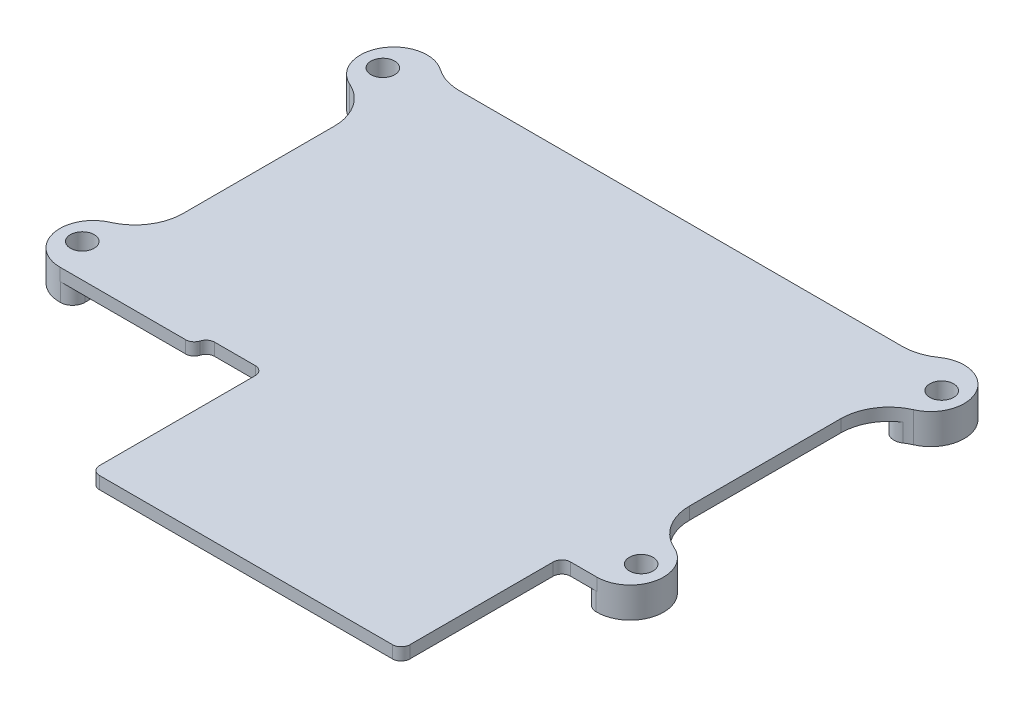
from build123d import *

# Parameters (mm, degrees)
SKETCH1_R             = 1.2192
BOSS_EXTRUDE1_DEPTH   = 3.1242
BOSS_EXTRUDE1_2_DEPTH = 3.1242
BOSS_EXTRUDE1_3_DEPTH = 3.1242
BOSS_EXTRUDE1_4_DEPTH = 3.1242
BOSS_EXTRUDE2_START   = -1.27
SKETCH2_R             = 1.2192
BOSS_EXTRUDE2_DEPTH   = 1.27
SKETCH4_W             = 5.9436
SKETCH4_H             = 1.27
CUT_EXTRUDE1_DEPTH    = 1.27
FILLET1_DEPTH         = 3.1242
FILLET1_START         = 1.8542
FILLET1_2_DEPTH       = 1.27
BOSS_EXTRUDE3_DEPTH   = 1.27
FILLET2_R             = 0.889
FILLET3_R             = 0.889
FILLET5_R             = 1.27


with BuildPart() as part:
    # Sketch1 → Boss-Extrude1 (new body)
    with BuildSketch(Plane(origin=(0, 0, 0), x_dir=(1, 0, 0), z_dir=(0, 1, 0))):
        with BuildLine():
            Line((26.2382, 18.587486955), (26.2382, 12.248113045))
            ThreePointArc((26.2382, 12.248113045), (30.9753, 15.4178), (26.2382, 18.587486955))
        make_face()
        with Locations(Location((28.67025, 15.4178, 0), (0, 0, 270))):
            Circle(SKETCH1_R, mode=Mode.SUBTRACT)
    extrude(amount=BOSS_EXTRUDE1_DEPTH)



with BuildPart() as body_2:
    # Sketch1 → Boss-Extrude1 2 (new body)
    with BuildSketch(Plane(origin=(0, 0, 0), x_dir=(1, 0, 0), z_dir=(0, 1, 0))):
        with BuildLine():
            Line((-26.2382, 18.587486955), (-26.2382, 12.248113045))
            ThreePointArc((-26.2382, 12.248113045), (-30.9753, 15.4178), (-26.2382, 18.587486955))
        make_face()
        with Locations(Location((-28.67025, 15.4178, 0), (0, 0, 270))):
            Circle(SKETCH1_R, mode=Mode.SUBTRACT)
    extrude(amount=BOSS_EXTRUDE1_2_DEPTH)


with BuildPart() as body_3:
    # Sketch1 → Boss-Extrude1 3 (new body)
    with BuildSketch(Plane(origin=(0, 0, 0), x_dir=(1, 0, 0), z_dir=(0, 1, 0))):
        with BuildLine():
            Line((26.2382, -12.248113045), (26.2382, -18.587486955))
            ThreePointArc((26.2382, -18.587486955), (30.9753, -15.4178), (26.2382, -12.248113045))
        make_face()
        with Locations(Location((28.67025, -15.4178, 0), (0, 0, 270))):
            Circle(SKETCH1_R, mode=Mode.SUBTRACT)
    extrude(amount=BOSS_EXTRUDE1_3_DEPTH)


with BuildPart() as body_4:
    # Sketch1 → Boss-Extrude1 4 (new body)
    with BuildSketch(Plane(origin=(0, 0, 0), x_dir=(1, 0, 0), z_dir=(0, 1, 0))):
        with BuildLine():
            Line((-26.2382, -12.248113045), (-26.2382, -18.587486955))
            ThreePointArc((-26.2382, -18.587486955), (-30.9753, -15.4178), (-26.2382, -12.248113045))
        make_face()
        with Locations(Location((-28.67025, -15.4178, 0), (0, 0, 270))):
            Circle(SKETCH1_R, mode=Mode.SUBTRACT)
    extrude(amount=BOSS_EXTRUDE1_4_DEPTH)


with BuildPart() as part_1:
    add(part.part)

    add(body_2.part)  # Boss-Extrude2 merges body 2

    add(body_3.part)  # Boss-Extrude2 merges body 3

    add(body_4.part)  # Boss-Extrude2 merges body 4
    # Sketch2 → Boss-Extrude2 (add)
    with BuildSketch(Plane(origin=(0, 3.1242, 0), x_dir=(1, 0, 0), z_dir=(0, 1, 0)).offset(BOSS_EXTRUDE2_START)):
        with BuildLine():
            Line((-24.695157071, 17.3228), (24.695157071, 17.3228))
            ThreePointArc((24.695157071, 17.3228), (30.864949116, 16.280707319), (25.9842, 12.365278978))
            Line((25.9842, 12.365278978), (25.9842, -12.365278978))
            ThreePointArc((25.9842, -12.365278978), (30.879851828, -14.614386528), (27.5463, -18.8468))
            Line((27.5463, -18.8468), (-27.5463, -18.8468))
            ThreePointArc((-27.5463, -18.8468), (-30.879851828, -14.614386528), (-25.9842, -12.365278978))
            Line((-25.9842, -12.365278978), (-25.9842, 12.365278978))
            ThreePointArc((-25.9842, 12.365278978), (-30.864949116, 16.280707319), (-24.695157071, 17.3228))
        make_face()
        with Locations(Location((28.67025, -15.4178, 0), (0, 0, 270))):
            Circle(SKETCH2_R, mode=Mode.SUBTRACT)
        with Locations(Location((28.67025, 15.4178, 0), (0, 0, 270))):
            Circle(SKETCH2_R, mode=Mode.SUBTRACT)
        with Locations(Location((-28.67025, 15.4178, 0), (0, 0, 270))):
            Circle(SKETCH2_R, mode=Mode.SUBTRACT)
        with Locations(Location((-28.67025, -15.4178, 0), (0, 0, 270))):
            Circle(SKETCH2_R, mode=Mode.SUBTRACT)
    extrude(amount=BOSS_EXTRUDE2_DEPTH)

    # Sketch4 → Cut-Extrude1 (cut)
    with BuildSketch(Plane(origin=(0, 3.1242, 0), x_dir=(1, 0, 0), z_dir=(0, 1, 0))):
        with Locations((-10.8458, -18.2118)):
            Rectangle(SKETCH4_W, SKETCH4_H)
    extrude(amount=-CUT_EXTRUDE1_DEPTH, mode=Mode.SUBTRACT)

    # Fillet1: read off the stored shape, not the designer's step
    # Fillet1 outline → Fillet1 (add)
    with BuildSketch(Plane(origin=(0, 0, 0), x_dir=(1, 0, 0), z_dir=(0, 1, 0))):
        with BuildLine():
            Line((26.2382, 12.248113045), (26.2382, 9.318072184))
            ThreePointArc((26.2382, 9.318072184), (27.272818982, 11.08465566), (28.933486364, 12.281918148))
            ThreePointArc((28.933486364, 12.281918148), (27.58930418, 11.989069675), (26.2382, 12.248113045))
        make_face()
        with BuildLine():
            ThreePointArc((28.933486364, -12.281918148), (27.272818982, -11.08465566), (26.2382, -9.318072184))
            Line((26.2382, -9.318072184), (26.2382, -12.248113045))
            ThreePointArc((26.2382, -12.248113045), (27.58930418, -11.989069675), (28.933486364, -12.281918148))
        make_face()
        with BuildLine():
            Line((-26.2382, 9.318072184), (-26.2382, 12.248113045))
            ThreePointArc((-26.2382, 12.248113045), (-27.58930418, 11.989069675), (-28.933486364, 12.281918148))
            ThreePointArc((-28.933486364, 12.281918148), (-27.272818982, 11.08465566), (-26.2382, 9.318072184))
        make_face()
        with BuildLine():
            Line((-26.2382, -12.248113045), (-26.2382, -9.318072184))
            ThreePointArc((-26.2382, -9.318072184), (-27.272818982, -11.08465566), (-28.933486364, -12.281918148))
            ThreePointArc((-28.933486364, -12.281918148), (-27.58930418, -11.989069675), (-26.2382, -12.248113045))
        make_face()
    extrude(amount=FILLET1_DEPTH)

    # Fillet1 2 outline → Fillet1 2 (add)
    with BuildSketch(Plane(origin=(0, 0, 0), x_dir=(1, 0, 0), z_dir=(0, 1, 0)).offset(FILLET1_START)):
        with BuildLine():
            ThreePointArc((25.9842, 7.752311027), (26.048112355, 8.545425773), (26.2382, 9.318072184))
            Line((26.2382, 9.318072184), (26.2382, 12.248113045))
            ThreePointArc((26.2382, 12.248113045), (26.110004775, 12.304104924), (25.9842, 12.365278978))
            Line((25.9842, 12.365278978), (25.9842, 7.752311027))
        make_face()
        with BuildLine():
            ThreePointArc((26.2382, -9.318072184), (26.048112355, -8.545425773), (25.9842, -7.752311027))
            Line((25.9842, -7.752311027), (25.9842, -12.365278978))
            ThreePointArc((25.9842, -12.365278978), (26.110004775, -12.304104924), (26.2382, -12.248113045))
            Line((26.2382, -12.248113045), (26.2382, -9.318072184))
        make_face()
        with BuildLine():
            Line((-25.9842, -12.365278978), (-25.9842, -7.752311027))
            ThreePointArc((-25.9842, -7.752311027), (-26.048112355, -8.545425773), (-26.2382, -9.318072184))
            Line((-26.2382, -9.318072184), (-26.2382, -12.248113045))
            ThreePointArc((-26.2382, -12.248113045), (-26.110004775, -12.304104924), (-25.9842, -12.365278978))
        make_face()
        with BuildLine():
            Line((-24.695157071, 17.3228), (-22.726988846, 17.3228))
            ThreePointArc((-22.726988846, 17.3228), (-24.220374536, 17.553299795), (-25.574763619, 18.223345455))
            ThreePointArc((-25.574763619, 18.223345455), (-25.093280542, 17.813783418), (-24.695157071, 17.3228))
        make_face()
        with BuildLine():
            ThreePointArc((24.695157071, 17.3228), (25.093280542, 17.813783418), (25.574763619, 18.223345455))
            ThreePointArc((25.574763619, 18.223345455), (24.220374536, 17.553299795), (22.726988846, 17.3228))
            Line((22.726988846, 17.3228), (24.695157071, 17.3228))
        make_face()
        with BuildLine():
            ThreePointArc((-25.9842, 12.365278978), (-26.110004775, 12.304104924), (-26.2382, 12.248113045))
            Line((-26.2382, 12.248113045), (-26.2382, 9.318072184))
            ThreePointArc((-26.2382, 9.318072184), (-26.048112355, 8.545425773), (-25.9842, 7.752311027))
            Line((-25.9842, 7.752311027), (-25.9842, 12.365278978))
        make_face()
    extrude(amount=FILLET1_2_DEPTH)

    # Sketch7 → Boss-Extrude3 (add)
    with BuildSketch(Plane(origin=(0, 3.1242, 0), x_dir=(1, 0, 0), z_dir=(0, 1, 0))):
        Polygon((-7.874, -25.0444), (-7.874, -35.3314), (23.9649, -35.3314), (23.9649, -25.0444), (23.9649, -18.8468), (-7.874, -18.8468), align=None)
    extrude(amount=-BOSS_EXTRUDE3_DEPTH)

    # Fillet2
    fillet2_edges = [part_1.edges().sort_by_distance(p)[0] for p in [
        (-13.8176, 2.4892, 17.5768),
        (-7.874, 2.4892, 17.5768),
        (23.9649, 2.4892, 18.8468),
    ]]
    fillet(fillet2_edges, radius=FILLET2_R)

    # Fillet3
    fillet3_edges = [part_1.edges().sort_by_distance(p)[0] for p in [
        (-13.8176, 2.4892, 18.8468),
        (23.9649, 2.4892, 35.3314),
        (-7.874, 2.4892, 35.3314),
    ]]
    fillet(fillet3_edges, radius=FILLET3_R)

    # Fillet5
    # the kernel refuses this fillet: 1.27 mm, written as the material it takes off along each edge
    with BuildSketch(Plane(origin=(26.2382, -9.068202779, -9.318072184), x_dir=(0, 0, -1), z_dir=(0, 1, 0)), Plane(origin=(-26.2382, -9.068202779, 9.318072184), x_dir=(0, 0, 1), z_dir=(0, 1, 0))) as fillet5_piece_1:
        with BuildLine():
            CenterArc((3.627281111, -1.27), FILLET5_R, 90, 123.437045448)
            ThreePointArc((2.567476567, -1.969795919), (1.449146976, -0.769300527), (0, 0))
            Line((0, 0), (3.627281111, 0))
        make_face()
    extrude(amount=10.922402779, mode=Mode.SUBTRACT)
    with BuildSketch(Plane(origin=(26.2382, -9.068202779, 9.318072184), x_dir=(0, 0, 1), z_dir=(0, 1, 0)), Plane(origin=(-26.2382, -9.068202779, -9.318072184), x_dir=(0, 0, -1), z_dir=(0, 1, 0))) as fillet5_piece_2:
        with BuildLine():
            CenterArc((3.627281111, 1.27), FILLET5_R, 146.562954552, 123.437045448)
            ThreePointArc((2.567476567, 1.969795919), (1.449146976, 0.769300527), (0, 0))
            Line((0, 0), (3.627281111, 0))
        make_face()
    extrude(amount=10.922402779, mode=Mode.SUBTRACT)
    with BuildSketch(Plane(origin=(26.2382, -3.185360081, -18.587486955), x_dir=(0, 0, 1), z_dir=(0, 1, 0))) as fillet5_piece_3:
        with BuildLine():
            CenterArc((1.011023157, 1.27), FILLET5_R, 181.011154478, 88.988845522)
            ThreePointArc((-0.258779077, 1.247588235), (-0.187845593, 0.61166896), (0, 0))
            Line((0, 0), (1.011023157, 0))
        make_face()
    extrude(amount=5.039560081, mode=Mode.SUBTRACT)
    with BuildSketch(Plane(origin=(-26.2382, -3.185360081, 18.587486955), x_dir=(-0.9791579315799205, 0, 0.20310033240773342), z_dir=(0, 1, 0))) as fillet5_piece_4:
        with BuildLine():
            CenterArc((1.038191434, -1.247888766), FILLET5_R, 79.292837609, 88.988845522)
            Line((-0.205339139, -0.989951343), (0, 0))
            ThreePointArc((0, 0), (0.637072016, 0.059700333), (1.274144032, 0))
        make_face()
    extrude(amount=5.039560081, mode=Mode.SUBTRACT)
    with BuildSketch(Plane(origin=(-26.2382, -3.185360081, -18.587486955), x_dir=(0, 0, 1), z_dir=(0, 1, 0))) as fillet5_piece_5:
        with BuildLine():
            CenterArc((1.011023157, -1.27), FILLET5_R, 90, 88.988845522)
            ThreePointArc((-0.258779077, -1.247588235), (-0.187845593, -0.61166896), (0, 0))
            Line((0, 0), (1.011023157, 0))
        make_face()
    extrude(amount=5.039560081, mode=Mode.SUBTRACT)
    with BuildSketch(Plane(origin=(26.2382, -3.185360081, 18.587486955), x_dir=(0.9791579315799218, 0, 0.2031003324077264), z_dir=(0, 1, 0))) as fillet5_piece_6:
        with BuildLine():
            CenterArc((1.038191434, 1.247888766), FILLET5_R, 191.718316869, 88.988845522)
            Line((-0.205339139, 0.989951343), (0, 0))
            ThreePointArc((0, 0), (0.637072016, -0.059700333), (1.274144032, 0))
        make_face()
    extrude(amount=5.039560081, mode=Mode.SUBTRACT)


solid = part_1.part
